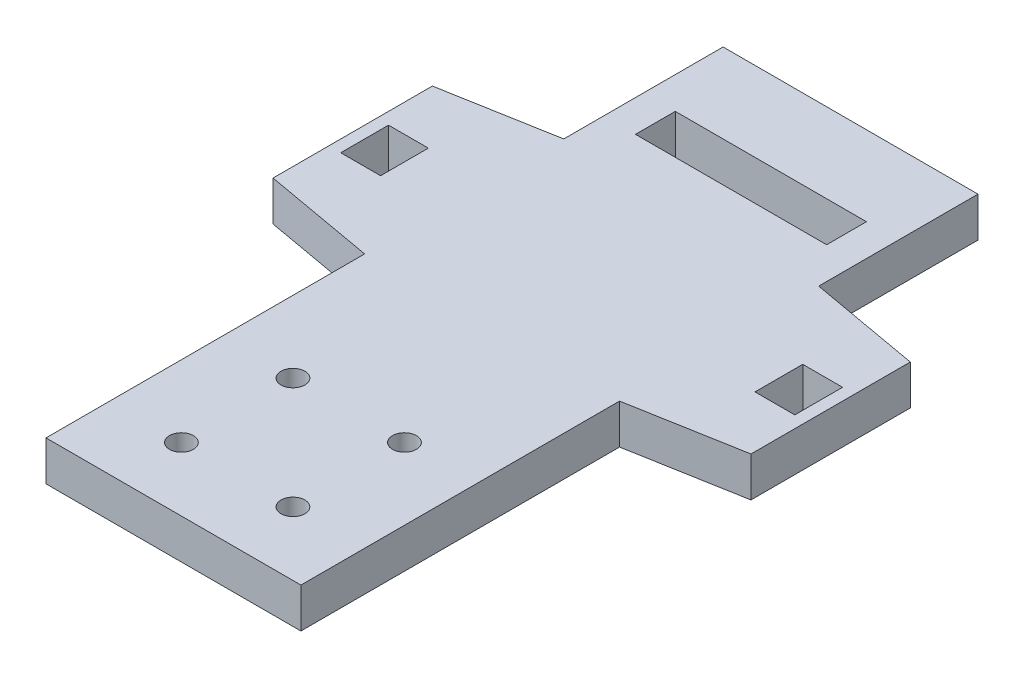
from build123d import *

# Parameters (mm, degrees)
BOSS_EXTRUDE1_DEPTH = 5
SKETCH2_R           = 1.5
SKETCH2_W           = 5
SKETCH2_H           = 6
SKETCH2_W_2         = 24
SKETCH2_H_2         = 5
CUT_EXTRUDE1_DEPTH  = 5


with BuildPart() as part:
    # Sketch1 → Boss-Extrude1 (new body)
    with BuildSketch(Plane(origin=(0, 0, 0), x_dir=(1, 0, 0), z_dir=(0, 1, 0))):
        Polygon((-16, -42.5), (16, -42.5), (16, -2.5), (30, 0), (30, 20), (16, 22.5), (16, 42.5), (-16, 42.5), (-16, 22.5), (-30, 20), (-30, 0), (-16, -2.5), align=None)
    extrude(amount=BOSS_EXTRUDE1_DEPTH)

    # Sketch2 → Cut-Extrude1 (cut)
    with BuildSketch(Plane(origin=(0, 5, 0), x_dir=(1, 0, 0), z_dir=(0, 1, 0))):
        with Locations((-7, -20.5)):
            Circle(SKETCH2_R)
        with Locations((7, -20.5)):
            Circle(SKETCH2_R)
        with Locations((-7, -34.5)):
            Circle(SKETCH2_R)
        with Locations((7, -34.5)):
            Circle(SKETCH2_R)
        with Locations((-26, 10)):
            Rectangle(SKETCH2_W, SKETCH2_H)
        with Locations((26, 10)):
            Rectangle(SKETCH2_W, SKETCH2_H)
        with Locations((0, 30)):
            Rectangle(SKETCH2_W_2, SKETCH2_H_2)
    extrude(amount=-CUT_EXTRUDE1_DEPTH, mode=Mode.SUBTRACT)


solid = part.part
